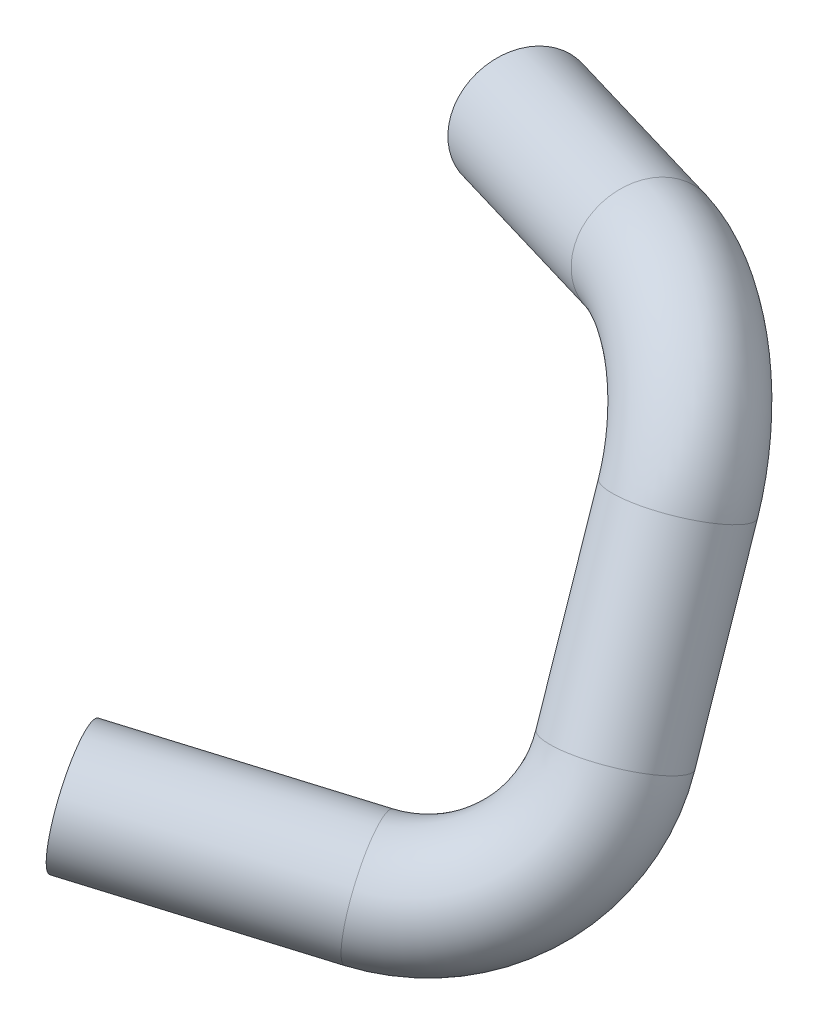
from build123d import *

# Parameters (mm, degrees)
SWEEP_SOTTILE1_PROFILE_R   = 3.175
SWEEP_SOTTILE1_PROFILE_R_2 = 2.325


with BuildPart() as part:
    # Sweep-Sottile1: sweep along a curve in space
    with BuildLine() as sweep_sottile1_path:
        Line((-26.865462484, -1.319578805, 27.359243174), (-21.558279201, -2.134095351, 24.681488818))
        Line((-16.139402673, -2.965753945, 21.94737932), (-21.558279201, -2.134095351, 24.681488818))
        ThreePointArc((-16.139402673, -2.965753945, 21.94737932), (-11.292193729, -1.598909493, 18.374309487), (-9.716090498, 3.233926671, 14.868582806))
        Line((-10.669409144, 12.472501866, 10.493247115), (-9.716090498, 3.233926671, 14.868582806))
        ThreePointArc((-17.751858156, 18.020311785, 5.184019113), (-12.960366508, 16.725311229, 7.716153393), (-10.669409144, 12.472501866, 10.493247115))
        Line((-17.751858156, 18.020311785, 5.184019113), (-28.425545748, 16.930941853, 1.25655118))
    # Sweep-Sottile1 profile (on start of the path) → Sweep-Sottile1 (sweep)
    with BuildSketch(Plane(origin=(-26.865462484, -1.319578805, 27.359243174), x_dir=(0.45046243787724455, 0, 0.8927953808469719), z_dir=(0.8845305472584387, -0.13575275761311742, -0.44629239268345283))):
        Circle(SWEEP_SOTTILE1_PROFILE_R)
        Circle(SWEEP_SOTTILE1_PROFILE_R_2, mode=Mode.SUBTRACT)
    sweep(path=sweep_sottile1_path.line)


solid = part.part
